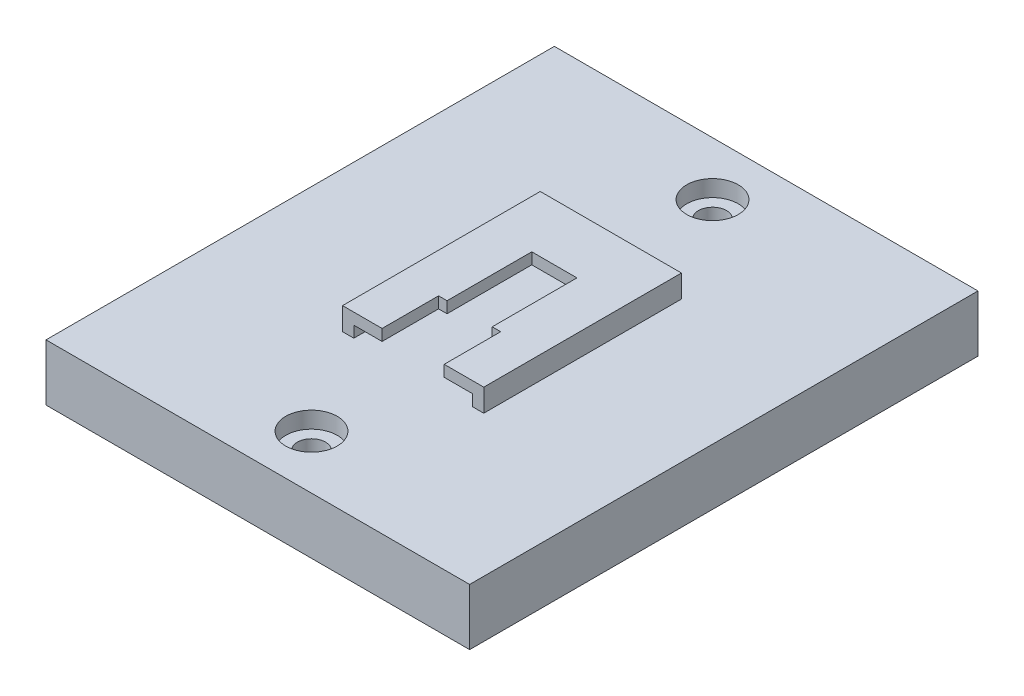
from build123d import *

# Parameters (mm, degrees)
BOSS_EXTRUDE1_DEPTH                             = 2
BOSS_EXTRUDE2_DEPTH                             = 2
SKETCH3_W                                       = 75
SKETCH3_H                                       = 90
BOSS_EXTRUDE3_DEPTH                             = 10
CBORE_FOR_8_PAN_HEAD_MACHINE_SCREW1_D           = 4.9784
CBORE_FOR_8_PAN_HEAD_MACHINE_SCREW1_CBORE_D     = 9.12876
CBORE_FOR_8_PAN_HEAD_MACHINE_SCREW1_CBORE_DEPTH = 2.921


with BuildPart() as part:
    # Sketch1 → Boss-Extrude1 (new body)
    with BuildSketch(Plane(origin=(0, 0, 0), x_dir=(1, 0, 0), z_dir=(0, 1, 0))):
        Polygon((12.5, 17.5), (-12.5, 17.5), (-12.5, -17.5), (-5.5, -17.5), (-5.5, -7.5), (-4, -7.5), (-4, 7.5), (4, 7.5), (4, -7.5), (5.5, -7.5), (5.5, -17.5), (12.5, -17.5), align=None)
    extrude(amount=BOSS_EXTRUDE1_DEPTH)

    # Sketch2 → Boss-Extrude2 (add)
    with BuildSketch(Plane.XZ):
        Polygon((-12.5, 17.5), (-12.5, -17.5), (12.5, -17.5), (12.5, 17.5), (10.5, 17.5), (10.5, -15.5), (-10.5, -15.5), (-10.5, 17.5), align=None)
    extrude(amount=BOSS_EXTRUDE2_DEPTH)

    # Sketch3 → Boss-Extrude3 (add)
    with BuildSketch(Plane.XZ.offset(2)):
        Rectangle(SKETCH3_W, SKETCH3_H)
    extrude(amount=BOSS_EXTRUDE3_DEPTH)

    # CBORE for #8 Pan Head Machine Screw1 (through all)
    with Locations(Plane(origin=(0, -2, 0), x_dir=(1, 0, 0), z_dir=(0, 1, 0))):
        with Locations((0, 35.5), (0, -35.5)):
            CounterBoreHole(CBORE_FOR_8_PAN_HEAD_MACHINE_SCREW1_D / 2, CBORE_FOR_8_PAN_HEAD_MACHINE_SCREW1_CBORE_D / 2, CBORE_FOR_8_PAN_HEAD_MACHINE_SCREW1_CBORE_DEPTH)


solid = part.part
